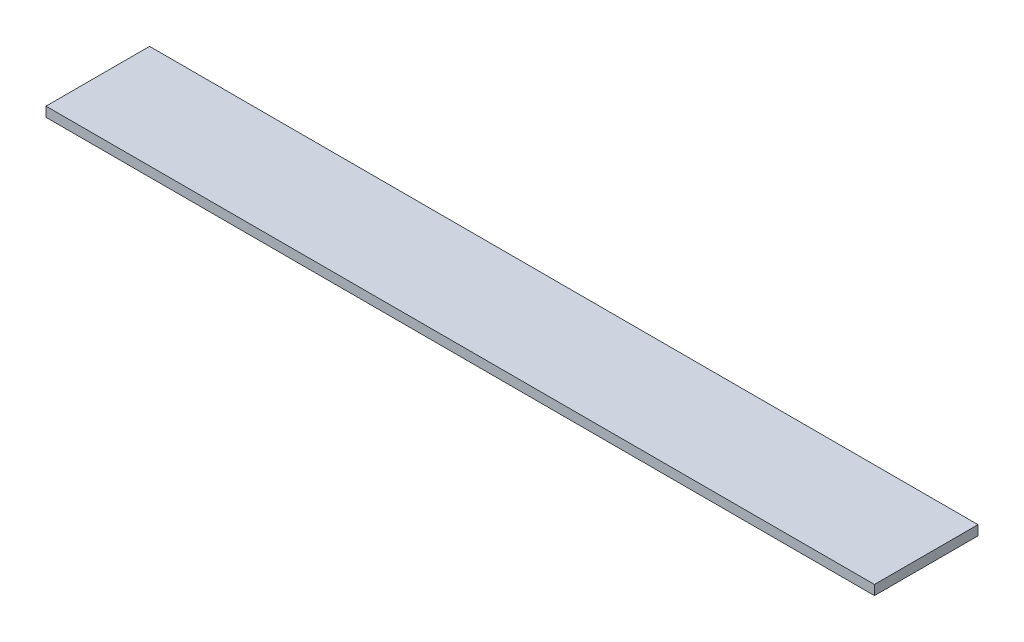
from build123d import *

# Parameters (mm, degrees)
SKETCH1_W           = 406.4
SKETCH1_H           = 50.8
BOSS_EXTRUDE1_DEPTH = 4.7625


with BuildPart() as part:
    # Sketch1 → Boss-Extrude1 (new body)
    with BuildSketch(Plane(origin=(0, 0, 0), x_dir=(1, 0, 0), z_dir=(0, 1, 0))):
        with Locations((203.2, 25.4)):
            Rectangle(SKETCH1_W, SKETCH1_H)
    extrude(amount=BOSS_EXTRUDE1_DEPTH)


solid = part.part
